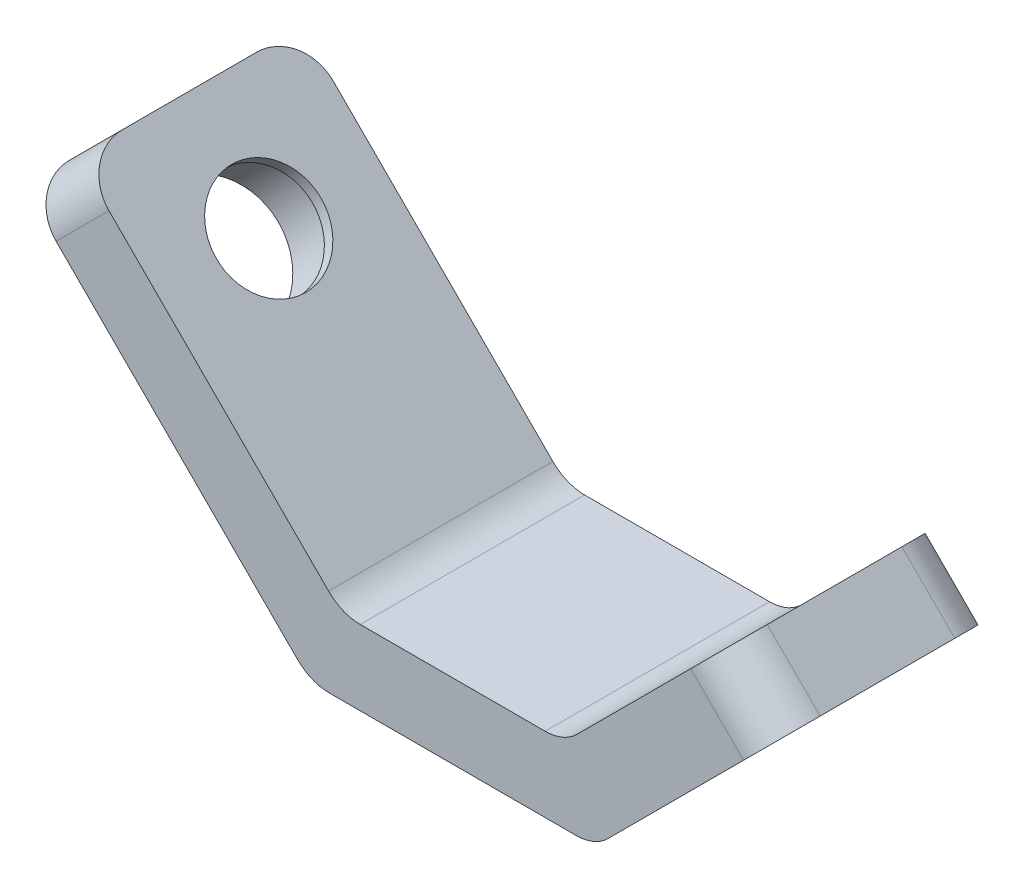
from build123d import *

# Parameters (mm, degrees)
EXTRUDE_1_DEPTH          = 7.5
CUT_EXTRUDE_1_DEPTH      = 35.35698236
CUT_EXTRUDE_1_DEPTH_BACK = 35.35698236
SKETCH_2_R               = 4.2
CUT_EXTRUDE_2_DEPTH      = 44.720704477
CUT_EXTRUDE_2_DEPTH_BACK = 44.720704477
SKETCH_3_R               = 4.2
FILLET_1_R               = 3
SKETCH_4_R               = 4.2
SKETCH_4_R_2             = 3.5
EXTRUDE_2_DEPTH          = 0.8
SKETCH_5_R               = 4.2
SKETCH_5_R_2             = 3.5
EXTRUDE_3_DEPTH          = 0.8


with BuildPart() as part:
    # ｽｹｯﾁ1 → ﾎﾞｽ - 押し出し1 (new, symmetric)
    with BuildSketch(Plane.XY):
        Polygon((0, 0), (-19.142135624, 19.142135624), (-15.606601718, 22.67766953), (2.071067812, 5), (16.920310217, 5), (27.526911935, 15.606601718), (31.062445841, 12.071067812), (18.991378029, 0), align=None)
    extrude(amount=EXTRUDE_1_DEPTH, both=True)

    # ｽｹｯﾁ2 → ｶｯﾄ - 押し出し1 (cut, two sides: drawn at the far end of the back side and taken through both)
    with BuildSketch(Plane(origin=(3.535533906, 3.535533906, 0), x_dir=(0, 0, 1), z_dir=(-0.7071067811865485, -0.7071067811865467, 0)).offset(-CUT_EXTRUDE_1_DEPTH_BACK)):
        with Locations((0, 19.571067812)):
            Circle(SKETCH_2_R)
    extrude(amount=CUT_EXTRUDE_1_DEPTH + CUT_EXTRUDE_1_DEPTH_BACK, mode=Mode.SUBTRACT)

    # ｽｹｯﾁ3 → ｶｯﾄ - 押し出し2 (cut, two sides: drawn at the far end of the back side and taken through both)
    with BuildSketch(Plane(origin=(9.495689014, -9.495689014, 0), x_dir=(0, 0, -1), z_dir=(0.707106781186549, -0.7071067811865461, 0)).offset(-CUT_EXTRUDE_2_DEPTH_BACK)):
        with Locations((0, 23)):
            Circle(SKETCH_3_R)
    extrude(amount=CUT_EXTRUDE_2_DEPTH + CUT_EXTRUDE_2_DEPTH_BACK, mode=Mode.SUBTRACT)

    # ﾌｨﾚｯﾄ1
    fillet_1_edges = [part.edges().sort_by_distance(p)[0] for p in [
        (29.294678888, 13.838834765, -7.5),
        (29.294678888, 13.838834765, 7.5),
        (-17.374368671, 20.909902577, -7.5),
        (-17.374368671, 20.909902577, 7.5),
        (18.991378029, 0, 0),
        (0, 0, 0),
        (16.920310217, 5, 0),
        (2.071067812, 5, 0),
    ]]
    fillet(fillet_1_edges, radius=FILLET_1_R)

    # ｽｹｯﾁ4 → ﾎﾞｽ - 押し出し2 (add)
    with BuildSketch(Plane(origin=(3.535533906, 3.535533906, 0), x_dir=(0, 0, 1), z_dir=(-0.7071067811865485, -0.7071067811865467, 0))):
        with Locations((0, 19.571067812)):
            Circle(SKETCH_4_R)
        with Locations((0, 19.571067812)):
            Circle(SKETCH_4_R_2, mode=Mode.SUBTRACT)
    extrude(amount=EXTRUDE_2_DEPTH)

    # ｽｹｯﾁ5 → ﾎﾞｽ - 押し出し3 (add)
    with BuildSketch(Plane(origin=(9.495689014, -9.495689014, 0), x_dir=(0, 0, 1), z_dir=(-0.7071067811865482, 0.7071067811865468, 0))):
        with Locations((0, 23)):
            Circle(SKETCH_5_R)
        with Locations((0, 23)):
            Circle(SKETCH_5_R_2, mode=Mode.SUBTRACT)
    extrude(amount=EXTRUDE_3_DEPTH)


solid = part.part
